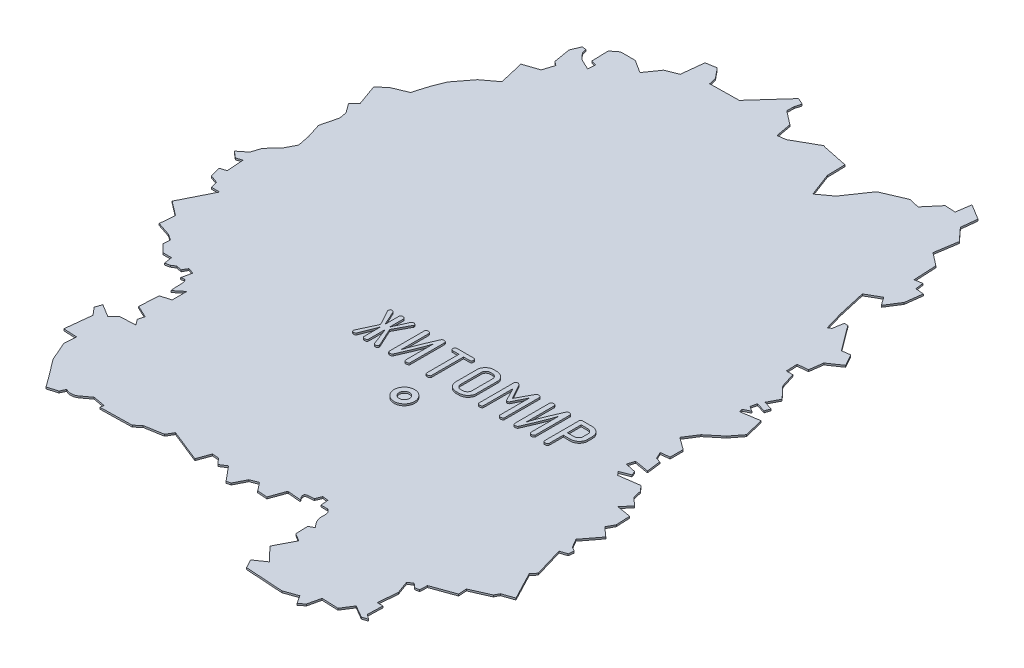
from build123d import *

# Parameters (mm, degrees)
EXTRUDE_1_DEPTH = 5
SKETCH_2_R      = 30
SKETCH_2_R_2    = 15
EXTRUDE_2_DEPTH = 10
SCALE_1_SCALE   = 0.05


with BuildPart() as part:
    # Эскиз1 → Бобышка-Вытянуть1 (new body)
    with BuildSketch(Plane(origin=(0, 0, 0), x_dir=(1, 0, 0), z_dir=(0, 1, 0))):
        with BuildLine():
            Line((-4534.03208, 8094.20784), (-4547.64648, 8104.5812))
            Line((-4547.64648, 8104.5812), (-4546.35616, 8148.71624))
            Line((-4546.35616, 8148.71624), (-4563.2116, 8148.71624))
            Line((-4563.2116, 8148.71624), (-4558.03508, 8205.16774))
            Line((-4558.03508, 8205.16774), (-4571.66218, 8242.80546))
            Line((-4571.66218, 8242.80546), (-4558.03508, 8251.24842))
            Line((-4558.03508, 8251.24842), (-4546.35616, 8240.86744))
            Line((-4546.35616, 8240.86744), (-4534.03208, 8242.80546))
            Line((-4534.03208, 8242.80546), (-4532.72652, 8264.86536))
            Line((-4532.72652, 8264.86536), (-4465.8915, 8288.88868))
            Line((-4465.8915, 8288.88868), (-4467.84222, 8312.90184))
            Line((-4467.84222, 8312.90184), (-4413.32112, 8336.90484))
            Line((-4413.32112, 8336.90484), (-4406.19134, 8350.5294))
            Line((-4406.19134, 8350.5294), (-4372.44744, 8362.21594))
            Line((-4372.44744, 8362.21594), (-4414.62668, 8442.68568))
            Line((-4414.62668, 8442.68568), (-4402.92744, 8457.60056))
            Line((-4402.92744, 8457.60056), (-4428.23854, 8543.27222))
            Line((-4428.23854, 8543.27222), (-4408.12936, 8549.76192))
            Line((-4408.12936, 8549.76192), (-4406.19134, 8565.3372))
            Line((-4406.19134, 8565.3372), (-4418.51542, 8572.46952))
            Line((-4418.51542, 8572.46952), (-4433.42268, 8597.77554))
            Line((-4433.42268, 8597.77554), (-4395.80782, 8647.10234))
            Line((-4395.80782, 8647.10234), (-4423.04424, 8671.11296))
            Line((-4423.04424, 8671.11296), (-4411.37802, 8693.17286))
            Line((-4411.37802, 8693.17286), (-4413.32112, 8734.06178))
            Line((-4413.32112, 8734.06178), (-4455.50798, 8741.20172))
            Line((-4455.50798, 8741.20172), (-4432.14506, 8766.50012))
            Line((-4432.14506, 8766.50012), (-4455.50798, 8789.21534))
            Line((-4455.50798, 8789.21534), (-4460.69212, 8812.58842))
            Line((-4460.69212, 8812.58842), (-4474.33192, 8828.15862))
            Line((-4474.33192, 8828.15862), (-4534.03208, 8819.72328))
            Line((-4534.03208, 8819.72328), (-4543.10496, 8830.11188))
            Line((-4543.10496, 8830.11188), (-4513.89496, 8841.77556))
            Line((-4513.89496, 8841.77556), (-4519.09942, 8854.11742))
            Line((-4519.09942, 8854.11742), (-4549.59466, 8860.58426))
            Line((-4549.59466, 8860.58426), (-4543.10496, 8881.34876))
            Line((-4543.10496, 8881.34876), (-4501.57596, 8874.2393))
            Line((-4501.57596, 8874.2393), (-4506.75756, 8915.10536))
            Line((-4506.75756, 8915.10536), (-4520.39736, 8919.0068))
            Line((-4520.39736, 8919.0068), (-4529.46262, 8939.12614))
            Line((-4529.46262, 8939.12614), (-4503.53176, 8942.38496))
            Line((-4503.53176, 8942.38496), (-4503.53176, 8979.99728))
            Line((-4503.53176, 8979.99728), (-4539.20606, 9005.96624))
            Line((-4539.20606, 9005.96624), (-4515.20814, 9043.59888))
            Line((-4515.20814, 9043.59888), (-4474.33192, 9077.34786))
            Line((-4474.33192, 9077.34786), (-4449.02082, 9109.79128))
            Line((-4449.02082, 9109.79128), (-4462.6403, 9166.2504))
            Line((-4462.6403, 9166.2504), (-4517.14616, 9157.8049))
            Line((-4517.14616, 9157.8049), (-4519.09942, 9167.55342))
            Line((-4519.09942, 9167.55342), (-4500.27548, 9176.63138))
            Line((-4500.27548, 9176.63138), (-4515.20814, 9186.36212))
            Line((-4515.20814, 9186.36212), (-4510.659, 9203.8805))
            Line((-4510.659, 9203.8805), (-4483.39972, 9195.45024))
            Line((-4483.39972, 9195.45024), (-4478.20796, 9210.37782))
            Line((-4478.20796, 9210.37782), (-4503.53176, 9218.82332))
            Line((-4503.53176, 9218.82332), (-4486.656, 9251.23626))
            Line((-4486.656, 9251.23626), (-4519.09942, 9285.66088))
            Line((-4519.09942, 9285.66088), (-4532.72652, 9328.48528))
            Line((-4532.72652, 9328.48528), (-4551.5403, 9328.48528))
            Line((-4551.5403, 9328.48528), (-4552.84586, 9360.91854))
            Line((-4552.84586, 9360.91854), (-4522.33538, 9364.17736))
            Line((-4522.33538, 9364.17736), (-4517.14616, 9403.14096))
            Line((-4517.14616, 9403.14096), (-4479.50336, 9429.05912))
            Line((-4479.50336, 9429.05912), (-4498.33238, 9462.83096))
            Line((-4498.33238, 9462.83096), (-4522.33538, 9459.57976))
            Line((-4522.33538, 9459.57976), (-4576.84632, 9532.89686))
            Line((-4576.84632, 9532.89686), (-4587.24, 9532.89686))
            Line((-4587.24, 9532.89686), (-4592.41906, 9502.40162))
            Line((-4592.41906, 9502.40162), (-4600.85948, 9497.21748))
            Line((-4600.85948, 9497.21748), (-4616.43476, 9550.41016))
            Line((-4616.43476, 9550.41016), (-4635.25362, 9633.48086))
            Line((-4635.25362, 9633.48086), (-4595.67534, 9656.20116))
            Line((-4595.67534, 9656.20116), (-4578.79958, 9632.19308))
            Line((-4578.79958, 9632.19308), (-4552.84586, 9673.05406))
            Line((-4552.84586, 9673.05406), (-4546.35616, 9722.38086))
            Line((-4546.35616, 9722.38086), (-4570.35916, 9724.34682))
            Line((-4570.35916, 9724.34682), (-4573.61544, 9748.34982))
            Line((-4573.61544, 9748.34982), (-4595.67534, 9744.44076))
            Line((-4595.67534, 9744.44076), (-4598.92908, 9811.30626))
            Line((-4598.92908, 9811.30626), (-4636.53632, 9840.47816))
            Line((-4636.53632, 9840.47816), (-4626.17058, 9906.68072))
            Line((-4626.17058, 9906.68072), (-4660.55456, 9944.33114))
            Line((-4660.55456, 9944.33114), (-4655.37042, 9990.40674))
            Line((-4655.37042, 9990.40674), (-4700.1557, 10017.65586))
            Line((-4700.1557, 10017.65586), (-4706.63524, 9974.83146))
            Line((-4706.63524, 9974.83146), (-4737.14572, 9976.77456))
            Line((-4737.14572, 9976.77456), (-4773.4855, 9933.94762))
            Line((-4773.4855, 9933.94762), (-4803.96296, 9941.07994))
            Line((-4803.96296, 9941.07994), (-4872.1137, 9911.86486))
            Line((-4872.1137, 9911.86486), (-4920.14002, 9841.79642))
            Line((-4920.14002, 9841.79642), (-4959.08076, 9813.24428))
            Line((-4959.08076, 9813.24428), (-4985.03956, 9881.3747))
            Line((-4985.03956, 9881.3747), (-4986.34258, 9933.94762))
            Line((-4986.34258, 9933.94762), (-5061.60278, 9949.53306))
            Line((-5061.60278, 9949.53306), (-5064.8489, 9951.4533))
            Line((-5064.8489, 9951.4533), (-5134.94528, 9911.86486))
            Line((-5134.94528, 9911.86486), (-5158.95082, 9908.62382))
            Line((-5158.95082, 9908.62382), (-5167.38108, 9954.69942))
            Line((-5167.38108, 9954.69942), (-5206.9619, 9985.21244))
            Line((-5206.9619, 9985.21244), (-5206.9619, 10005.96424))
            Line((-5206.9619, 10005.96424), (-5201.76506, 10024.7704))
            Line((-5201.76506, 10024.7704), (-5220.60424, 10033.23622))
            Line((-5220.60424, 10033.23622), (-5302.34144, 9942.37788))
            Line((-5302.34144, 9942.37788), (-5387.35778, 9941.07994))
            Line((-5387.35778, 9941.07994), (-5392.5724, 9963.14492))
            Line((-5392.5724, 9963.14492), (-5416.58556, 9992.34984))
            Line((-5416.58556, 9992.34984), (-5447.05794, 9987.14284))
            Line((-5447.05794, 9987.14284), (-5454.20296, 9922.26616))
            Line((-5454.20296, 9922.26616), (-5488.6098, 9908.62382))
            Line((-5488.6098, 9908.62382), (-5517.14924, 9867.74252))
            Line((-5517.14924, 9867.74252), (-5554.80474, 9891.77092))
            Line((-5554.80474, 9891.77092), (-5597.62914, 9891.77092))
            Line((-5597.62914, 9891.77092), (-5617.74594, 9876.17278))
            Line((-5617.74594, 9876.17278), (-5616.448, 9826.87138))
            Line((-5616.448, 9826.87138), (-5600.87526, 9822.96994))
            Line((-5600.87526, 9822.96994), (-5602.80566, 9800.90496))
            Line((-5602.80566, 9800.90496), (-5635.26178, 9816.46246))
            Line((-5635.26178, 9816.46246), (-5650.19444, 9833.36108))
            Line((-5650.19444, 9833.36108), (-5654.08318, 9846.9704))
            Line((-5654.08318, 9846.9704), (-5665.77734, 9848.93636))
            Line((-5665.77734, 9848.93636), (-5677.44356, 9821.67454))
            Line((-5677.44356, 9821.67454), (-5669.01584, 9771.70004))
            Line((-5669.01584, 9771.70004), (-5657.33438, 9763.2774))
            Line((-5657.33438, 9763.2774), (-5667.70774, 9730.82636))
            Line((-5667.70774, 9730.82636), (-5711.8377, 9715.89878))
            Line((-5711.8377, 9715.89878), (-5694.96194, 9643.86692))
            Line((-5694.96194, 9643.86692), (-5735.8661, 9613.3539))
            Line((-5735.8661, 9613.3539), (-5773.49874, 9564.04488))
            add(Edge.make_bspline(
                [(-5773.49874, 9564.04488), (-5790.35926, 9523.15088), (-5793.59268, 9508.88624)],
                knots=[0.538135593, 0.538135593, 0.538135593, 0.542372881, 0.542372881, 0.542372881], degree=2))
            add(Edge.make_bspline(
                [(-5793.59268, 9508.88624), (-5797.4865, 9495.26168), (-5800.73008, 9483.58784)],
                knots=[0.542372881, 0.542372881, 0.542372881, 0.546610169, 0.546610169, 0.546610169], degree=2))
            Line((-5800.73008, 9483.58784), (-5841.62916, 9466.69176))
            Line((-5841.62916, 9466.69176), (-5868.88336, 9444.63186))
            Line((-5868.88336, 9444.63186), (-5846.8133, 9383.00384))
            Line((-5846.8133, 9383.00384), (-5863.69414, 9366.12046))
            Line((-5863.69414, 9366.12046), (-5843.56718, 9338.2211))
            Line((-5843.56718, 9338.2211), (-5839.67336, 9316.1612))
            Line((-5839.67336, 9316.1612), (-5852.00252, 9266.82424))
            Line((-5852.00252, 9266.82424), (-5838.37796, 9224.01254))
            Line((-5838.37796, 9224.01254), (-5831.2431, 9188.31538))
            Line((-5831.2431, 9188.31538), (-5848.11886, 9155.85926))
            Line((-5848.11886, 9155.85926), (-5855.25372, 9149.37464))
            Line((-5855.25372, 9149.37464), (-5876.01822, 9126.67466))
            Line((-5876.01822, 9126.67466), (-5884.45102, 9099.40522))
            Line((-5884.45102, 9099.40522), (-5909.75958, 9079.29604))
            Line((-5909.75958, 9079.29604), (-5890.94326, 9063.7106))
            Line((-5890.94326, 9063.7106), (-5874.07258, 9068.89474))
            Line((-5874.07258, 9068.89474), (-5870.83408, 9019.59842))
            Line((-5870.83408, 9019.59842), (-5889.00016, 9013.74372))
            Line((-5889.00016, 9013.74372), (-5880.5572, 8983.24848))
            Line((-5880.5572, 8983.24848), (-5857.2146, 8974.81314))
            Line((-5857.2146, 8974.81314), (-5852.00252, 8954.69634))
            Line((-5852.00252, 8954.69634), (-5827.99444, 8954.69634))
            Line((-5827.99444, 8954.69634), (-5874.07258, 8862.53244))
            Line((-5874.07258, 8862.53244), (-5833.19382, 8831.39712))
            Line((-5833.19382, 8831.39712), (-5836.43994, 8787.26716))
            Line((-5836.43994, 8787.26716), (-5795.54086, 8773.64006))
            Line((-5795.54086, 8773.64006), (-5778.6778, 8761.95352))
            Line((-5778.6778, 8761.95352), (-5779.97828, 8741.20172))
            Line((-5779.97828, 8741.20172), (-5757.90822, 8719.12912))
            Line((-5757.90822, 8719.12912), (-5732.60474, 8719.12912))
            Line((-5732.60474, 8719.12912), (-5728.72616, 8695.10834))
            Line((-5728.72616, 8695.10834), (-5715.1016, 8698.35446))
            Line((-5715.1016, 8698.35446), (-5703.38712, 8705.50202))
            Line((-5703.38712, 8705.50202), (-5687.82962, 8702.26098))
            Line((-5687.82962, 8702.26098), (-5679.38666, 8717.18602))
            Line((-5679.38666, 8717.18602), (-5662.51852, 8710.69124))
            Line((-5662.51852, 8710.69124), (-5669.01584, 8681.49648))
            add(Edge.make_bspline(
                [(-5669.01584, 8681.49648), (-5652.13754, 8689.9496), (-5652.13754, 8665.91612)],
                knots=[0.703389831, 0.703389831, 0.703389831, 0.707627119, 0.707627119, 0.707627119], degree=2))
            add(Edge.make_bspline(
                [(-5652.13754, 8665.91612), (-5652.13754, 8641.90804), (-5650.19444, 8635.42342)],
                knots=[0.707627119, 0.707627119, 0.707627119, 0.711864407, 0.711864407, 0.711864407], degree=2))
            Line((-5650.19444, 8635.42342), (-5624.89096, 8656.18792))
            Line((-5624.89096, 8656.18792), (-5624.89096, 8613.35844))
            Line((-5624.89096, 8613.35844), (-5654.08318, 8604.9231))
            Line((-5654.08318, 8604.9231), (-5657.33438, 8548.44874))
            Line((-5657.33438, 8548.44874), (-5621.65246, 8531.58568))
            Line((-5621.65246, 8531.58568), (-5626.84168, 8514.0673))
            Line((-5626.84168, 8514.0673), (-5614.5049, 8497.18646))
            Line((-5614.5049, 8497.18646), (-5659.27748, 8495.2459))
            Line((-5659.27748, 8495.2459), (-5677.44356, 8478.37014))
            Line((-5677.44356, 8478.37014), (-5713.7935, 8500.43512))
            Line((-5713.7935, 8500.43512), (-5720.27812, 8481.62388))
            Line((-5720.27812, 8481.62388), (-5701.45418, 8459.5462))
            Line((-5701.45418, 8459.5462), (-5709.88952, 8382.98044))
            Line((-5709.88952, 8382.98044), (-5670.94624, 8381.02464))
            Line((-5670.94624, 8381.02464), (-5672.90204, 8345.3351))
            Line((-5672.90204, 8345.3351), (-5648.88126, 8290.83686))
            Line((-5648.88126, 8290.83686), (-5604.12138, 8231.12654))
            Line((-5604.12138, 8231.12654), (-5589.19888, 8210.3722))
            Line((-5589.19888, 8210.3722), (-5559.98126, 8218.80754))
            Line((-5559.98126, 8218.80754), (-5552.85402, 8234.37774))
            add(Edge.make_bspline(
                [(-5552.85402, 8234.37774), (-5532.73976, 8223.9866), (-5515.88178, 8237.62386)],
                knots=[0.796610169, 0.796610169, 0.796610169, 0.800847458, 0.800847458, 0.800847458], degree=2))
            add(Edge.make_bspline(
                [(-5515.88178, 8237.62386), (-5498.34562, 8251.24842), (-5493.1564, 8254.492)],
                knots=[0.800847458, 0.800847458, 0.800847458, 0.805084746, 0.805084746, 0.805084746], degree=2))
            Line((-5493.1564, 8254.492), (-5457.45924, 8247.99722))
            Line((-5457.45924, 8247.99722), (-5459.39726, 8237.62386))
            Line((-5459.39726, 8237.62386), (-5367.2486, 8239.57204))
            Line((-5367.2486, 8239.57204), (-5350.37792, 8254.492))
            Line((-5350.37792, 8254.492), (-5297.17, 8263.58774))
            Line((-5297.17, 8263.58774), (-5285.47838, 8283.69184))
            Line((-5285.47838, 8283.69184), (-5191.39932, 8246.05666))
            Line((-5191.39932, 8246.05666), (-5177.75952, 8283.69184))
            Line((-5177.75952, 8283.69184), (-5158.95082, 8282.39644))
            Line((-5158.95082, 8282.39644), (-5143.38316, 8264.86536))
            Line((-5143.38316, 8264.86536), (-5124.55668, 8277.1996))
            Line((-5124.55668, 8277.1996), (-5088.8646, 8234.37774))
            Line((-5088.8646, 8234.37774), (-5077.19076, 8237.62386))
            Line((-5077.19076, 8237.62386), (-5059.6546, 8272.01038))
            Line((-5059.6546, 8272.01038), (-5037.57692, 8280.44064))
            Line((-5037.57692, 8280.44064), (-5018.78854, 8256.44272))
            Line((-5018.78854, 8256.44272), (-4990.2237, 8254.492))
            Line((-4990.2237, 8254.492), (-4974.63826, 8297.32402))
            Line((-4974.63826, 8297.32402), (-4971.4023, 8299.27728))
            Line((-4971.4023, 8299.27728), (-4933.75696, 8296.01338))
            add(Edge.make_bspline(
                [(-4933.75696, 8296.01338), (-4950.62764, 8316.15558), (-4933.75696, 8318.08598)],
                knots=[0.889830508, 0.889830508, 0.889830508, 0.894067797, 0.894067797, 0.894067797], degree=2))
            Line((-4933.75696, 8318.08598), (-4916.8939, 8319.39408))
            Line((-4916.8939, 8319.39408), (-4909.76666, 8336.90484))
            Line((-4909.76666, 8336.90484), (-4892.88836, 8334.96682))
            Line((-4892.88836, 8334.96682), (-4890.94018, 8312.90184))
            Line((-4890.94018, 8312.90184), (-4872.1137, 8312.90184))
            add(Edge.make_bspline(
                [(-4872.1137, 8312.90184), (-4858.48406, 8307.69484), (-4860.43224, 8286.93288)],
                knots=[0.915254237, 0.915254237, 0.915254237, 0.919491525, 0.919491525, 0.919491525], degree=2))
            add(Edge.make_bspline(
                [(-4860.43224, 8286.93288), (-4861.74034, 8266.81608), (-4841.61846, 8247.99722)],
                knots=[0.919491525, 0.919491525, 0.919491525, 0.923728814, 0.923728814, 0.923728814], degree=2))
            Line((-4841.61846, 8247.99722), (-4856.53588, 8239.57204))
            Line((-4856.53588, 8239.57204), (-4855.23286, 8203.87488))
            Line((-4855.23286, 8203.87488), (-4833.19074, 8190.25286))
            Line((-4833.19074, 8190.25286), (-4861.74034, 8135.0993))
            Line((-4861.74034, 8135.0993), (-4822.78944, 8094.20784))
            Line((-4822.78944, 8094.20784), (-4855.23286, 8072.14032))
            Line((-4855.23286, 8072.14032), (-4841.61846, 8046.83684))
            Line((-4841.61846, 8046.83684), (-4731.9565, 8039.6842))
            Line((-4731.9565, 8039.6842), (-4693.01068, 8053.32146))
            Line((-4693.01068, 8053.32146), (-4677.43032, 8029.31338))
            Line((-4677.43032, 8029.31338), (-4662.51036, 8042.93794))
            Line((-4662.51036, 8042.93794), (-4654.06232, 8079.2828))
            Line((-4654.06232, 8079.2828), (-4606.03854, 8077.33208))
            Line((-4606.03854, 8077.33208), (-4585.2842, 8109.77042))
            Line((-4585.2842, 8109.77042), (-4549.59466, 8089.00592))
            Line((-4549.59466, 8089.00592), (-4534.03208, 8094.20784))
        make_face()
    extrude(amount=EXTRUDE_1_DEPTH)

    # Эскиз2 → Бобышка-Вытянуть2 (add)
    # profile 1 of 8: a face of its own
    with BuildSketch(Plane(origin=(0, 0, 0), x_dir=(1, 0, 0), z_dir=(0, 1, 0))):
        with Locations((-5040.921357821, 8705.513522828)):
            Circle(SKETCH_2_R)
        with Locations((-5040.921357821, 8705.513522828)):
            Circle(SKETCH_2_R_2, mode=Mode.SUBTRACT)
    # profile 2 of 8: a face of its own
    with BuildSketch(Plane(origin=(0, 0, 0), x_dir=(1, 0, 0), z_dir=(0, 1, 0))):
        with BuildLine():
            Line((-5235.044519459, 8856.345763436), (-5215.720195135, 8899.477097895))
            add(Edge.make_bspline(
                [(-5215.720195135, 8899.477097895), (-5215.447552976, 8899.912742392), (-5214.925898163, 8900.746274704), (-5213.826145908, 8901.675135607), (-5212.551803219, 8902.258572021), (-5211.63867427, 8902.323622805), (-5211.16783027, 8902.357165463)],
                knots=[0, 0, 0, 0, 1.08367056, 2.073420948, 3.006582599, 4, 4, 4, 4], degree=3))
            add(Edge.make_bspline(
                [(-5211.16783027, 8902.357165463), (-5210.61749674, 8902.336715346), (-5209.581150137, 8902.298205227), (-5208.128607422, 8902.085990385), (-5206.886084355, 8901.669929196), (-5205.874182527, 8901.063223473), (-5205.063635257, 8900.294099051), (-5204.497485605, 8899.339207453), (-5204.170385376, 8898.212581613), (-5204.128837464, 8897.412188015), (-5204.107019459, 8896.991878301)],
                knots=[0, 0, 0, 0, 1.307585369, 2.462346159, 3.474162086, 4.39812442, 5.243351347, 6.101086129, 7.002825675, 8, 8, 8, 8], degree=3))
            add(Edge.make_bspline(
                [(-5204.107019459, 8896.991878301), (-5204.122749829, 8896.685974431), (-5204.152090821, 8896.115388813), (-5204.502093551, 8895.666956641), (-5204.664451892, 8895.458939111)],
                knots=[0, 0, 0, 0, 1.072245288, 2, 2, 2, 2], degree=3))
            Line((-5204.664451892, 8895.458939111), (-5228.726951892, 8850.260459382))
            Line((-5228.726951892, 8850.260459382), (-5204.850262703, 8798.605053976))
            add(Edge.make_bspline(
                [(-5204.850262703, 8798.605053976), (-5204.635496002, 8798.133024247), (-5204.266716958, 8797.322495092), (-5204.154065732, 8796.441365713), (-5204.107019459, 8796.073381679)],
                knots=[0, 0, 0, 0, 1.164744604, 2, 2, 2, 2], degree=3))
            add(Edge.make_bspline(
                [(-5204.107019459, 8796.073381679), (-5204.132238547, 8795.669548426), (-5204.180534174, 8794.896190525), (-5204.464614269, 8793.799211728), (-5205.033605898, 8792.886650606), (-5205.787894231, 8792.110808305), (-5206.802476837, 8791.574592496), (-5207.984795839, 8791.135796558), (-5209.39612967, 8790.93113889), (-5210.401055248, 8790.891671403), (-5210.935566757, 8790.870678976)],
                knots=[0, 0, 0, 0, 0.9922728, 1.900244727, 2.743954077, 3.603549897, 4.5223843, 5.531780499, 6.687174694, 8, 8, 8, 8], degree=3))
            add(Edge.make_bspline(
                [(-5210.935566757, 8790.870678976), (-5211.476403395, 8790.907605193), (-5212.511259878, 8790.978261159), (-5213.938471072, 8791.616784104), (-5215.080331509, 8792.699436079), (-5215.575855192, 8793.632109167), (-5215.836326892, 8794.122368165)],
                knots=[0, 0, 0, 0, 1.035208426, 1.980805432, 2.938611697, 4, 4, 4, 4], degree=3))
            Line((-5215.836326892, 8794.122368165), (-5235.044519459, 8844.151928976))
            Line((-5235.044519459, 8844.151928976), (-5235.044519459, 8796.235966138))
            add(Edge.make_bspline(
                [(-5235.044519459, 8796.235966138), (-5235.064041211, 8795.815002994), (-5235.101322495, 8795.011076821), (-5235.461155188, 8793.887001358), (-5236.0485334, 8792.923561205), (-5236.909662856, 8792.165494543), (-5237.970469254, 8791.55219605), (-5239.277378259, 8791.143885328), (-5240.805148469, 8790.928357889), (-5241.895580151, 8790.890736891), (-5242.476951892, 8790.870678976)],
                knots=[0, 0, 0, 0, 0.966526808, 1.845805764, 2.686487088, 3.531690263, 4.457941251, 5.489333743, 6.661419661, 8, 8, 8, 8], degree=3))
            add(Edge.make_bspline(
                [(-5242.476951892, 8790.870678976), (-5242.94234459, 8790.890767268), (-5243.81755843, 8790.928545152), (-5245.047651756, 8791.146169527), (-5246.101203717, 8791.56238172), (-5246.949163942, 8792.181370745), (-5247.636304727, 8792.948438389), (-5248.095484682, 8793.906008513), (-5248.378273452, 8795.019826641), (-5248.407487997, 8795.816004825), (-5248.422897838, 8796.235966138)],
                knots=[0, 0, 0, 0, 1.21810231, 2.290753602, 3.253748033, 4.153293275, 5.014621679, 5.920530636, 6.903139142, 8, 8, 8, 8], degree=3))
            Line((-5248.422897838, 8796.235966138), (-5248.422897838, 8843.849986409))
            Line((-5248.422897838, 8843.849986409), (-5267.654316757, 8793.959783706))
            add(Edge.make_bspline(
                [(-5267.654316757, 8793.959783706), (-5267.94309168, 8793.48594188), (-5268.519724231, 8792.539763387), (-5269.939262556, 8791.536853233), (-5271.712415273, 8790.946067422), (-5273.014226966, 8790.897094079), (-5273.716394459, 8790.870678976)],
                knots=[0, 0, 0, 0, 0.91842489, 1.833932402, 2.831672611, 4, 4, 4, 4], degree=3))
            add(Edge.make_bspline(
                [(-5273.716394459, 8790.870678976), (-5274.142960596, 8790.891095102), (-5274.94879403, 8790.929663557), (-5276.089517131, 8791.14634602), (-5277.050121468, 8791.569688206), (-5277.860435397, 8792.140306094), (-5278.468366361, 8792.900197981), (-5278.896879056, 8793.82394652), (-5279.145047839, 8794.899251576), (-5279.179661412, 8795.669467109), (-5279.197813378, 8796.073381679)],
                knots=[0, 0, 0, 0, 1.184370061, 2.237413877, 3.199106753, 4.075474386, 4.961005186, 5.864072952, 6.879882294, 8, 8, 8, 8], degree=3))
            add(Edge.make_bspline(
                [(-5279.197813378, 8796.073381679), (-5279.174654937, 8796.481567403), (-5279.127418154, 8797.314152816), (-5278.789436427, 8798.076896898), (-5278.617154595, 8798.465695868)],
                knots=[0, 0, 0, 0, 0.980525764, 2, 2, 2, 2], degree=3))
            Line((-5278.617154595, 8798.465695868), (-5254.577880946, 8850.144327625))
            Line((-5254.577880946, 8850.144327625), (-5278.501022838, 8894.320847895))
            add(Edge.make_bspline(
                [(-5278.501022838, 8894.320847895), (-5278.698424858, 8894.747361508), (-5279.091173285, 8895.595947305), (-5279.16239093, 8896.528194404), (-5279.197813378, 8896.991878301)],
                knots=[0, 0, 0, 0, 1.005233919, 2, 2, 2, 2], degree=3))
            add(Edge.make_bspline(
                [(-5279.197813378, 8896.991878301), (-5279.179993594, 8897.411309853), (-5279.1462884, 8898.204642792), (-5278.895871091, 8899.320129436), (-5278.456807076, 8900.269880213), (-5277.823217858, 8901.037545569), (-5277.043840079, 8901.665208284), (-5276.056890755, 8902.082125901), (-5274.902629225, 8902.298214013), (-5274.081172474, 8902.336772444), (-5273.646715405, 8902.357165463)],
                knots=[0, 0, 0, 0, 1.137340688, 2.151220681, 3.081358687, 3.94738892, 4.829820309, 5.770335428, 6.82076137, 8, 8, 8, 8], degree=3))
            add(Edge.make_bspline(
                [(-5273.646715405, 8902.357165463), (-5272.9917798, 8902.325288781), (-5271.764946263, 8902.265576984), (-5270.077730903, 8901.727027515), (-5268.693296585, 8900.806132831), (-5268.108400953, 8899.919151046), (-5267.816901216, 8899.477097895)],
                knots=[0, 0, 0, 0, 1.147617683, 2.149731744, 3.077865041, 4, 4, 4, 4], degree=3))
            Line((-5267.816901216, 8899.477097895), (-5248.422897838, 8856.647706003))
            Line((-5248.422897838, 8856.647706003), (-5248.422897838, 8896.922199246))
            add(Edge.make_bspline(
                [(-5248.422897838, 8896.922199246), (-5248.407564754, 8897.349609443), (-5248.378744146, 8898.152984825), (-5248.097745142, 8899.288994431), (-5247.606954109, 8900.244978102), (-5246.940834966, 8901.057238432), (-5246.048025669, 8901.631283985), (-5244.994194272, 8902.059430234), (-5243.749882082, 8902.305987251), (-5242.857396454, 8902.339428918), (-5242.384046486, 8902.357165463)],
                knots=[0, 0, 0, 0, 1.101664502, 2.070727719, 2.99099469, 3.855584345, 4.74766418, 5.697383702, 6.778755293, 8, 8, 8, 8], degree=3))
            add(Edge.make_bspline(
                [(-5242.384046486, 8902.357165463), (-5241.809899204, 8902.34039693), (-5240.732645513, 8902.308934684), (-5239.225449291, 8902.051994722), (-5237.935799615, 8901.653999795), (-5236.870666151, 8901.05813166), (-5236.021183022, 8900.284313715), (-5235.471106131, 8899.292084193), (-5235.09630235, 8898.164258078), (-5235.062416812, 8897.351483221), (-5235.044519459, 8896.922199246)],
                knots=[0, 0, 0, 0, 1.324251331, 2.484649284, 3.518749735, 4.423044346, 5.282625393, 6.13155354, 7.013141075, 8, 8, 8, 8], degree=3))
            Line((-5235.044519459, 8896.922199246), (-5235.044519459, 8856.345763436))
        make_face()
    # profile 3 of 8: a face of its own
    with BuildSketch(Plane(origin=(0, 0, 0), x_dir=(1, 0, 0), z_dir=(0, 1, 0))):
        with BuildLine():
            add(Edge.make_bspline(
                [(-5115.233708649, 8797.652773571), (-5115.254387782, 8797.239956294), (-5115.294231203, 8796.444562572), (-5115.643583111, 8795.330114687), (-5116.246912519, 8794.386018159), (-5117.091569407, 8793.624731223), (-5118.167658908, 8793.044785275), (-5119.465176532, 8792.628044015), (-5120.994764632, 8792.415558948), (-5122.084917821, 8792.377471871), (-5122.666141081, 8792.357165463)],
                knots=[0, 0, 0, 0, 0.953740082, 1.837614163, 2.667550865, 3.517171085, 4.439430397, 5.476212962, 6.654424219, 8, 8, 8, 8], degree=3))
            add(Edge.make_bspline(
                [(-5122.666141081, 8792.357165463), (-5123.131392255, 8792.377446572), (-5124.006339946, 8792.415587067), (-5125.23818802, 8792.630820711), (-5126.281840695, 8793.05313412), (-5127.146020506, 8793.642048073), (-5127.817337806, 8794.409286616), (-5128.286211663, 8795.343783561), (-5128.567173527, 8796.43668562), (-5128.596569794, 8797.217423673), (-5128.612087027, 8797.629547219)],
                knots=[0, 0, 0, 0, 1.228791976, 2.310856505, 3.282301858, 4.177930221, 5.04681736, 5.942445723, 6.913891076, 8, 8, 8, 8], degree=3))
            Line((-5128.612087027, 8797.629547219), (-5128.612087027, 8877.597874922))
            add(Edge.make_bspline(
                [(-5128.612087027, 8877.597874922), (-5128.877125109, 8876.636098765), (-5129.439495126, 8874.595357789), (-5130.452919551, 8871.414055512), (-5131.585219902, 8867.907271391), (-5132.922418084, 8864.104853079), (-5134.397182157, 8859.981601085), (-5136.060255154, 8855.558020815), (-5137.866126019, 8850.825250328), (-5139.843911844, 8845.786338442), (-5141.981169542, 8840.433418579), (-5144.305944287, 8834.777800429), (-5146.789877784, 8828.808007928), (-5149.444641934, 8822.532023695), (-5152.249133234, 8815.940914992), (-5155.225581145, 8809.044132617), (-5158.355237611, 8801.837889514), (-5160.529203976, 8796.946643828), (-5161.639958649, 8794.447537084)],
                knots=[0, 0, 0, 0, 0.534819233, 1.134804096, 1.789814632, 2.510503038, 3.295666462, 4.137599038, 5.044164315, 6.011541378, 7.039786653, 8.134359685, 9.289900099, 10.506440011, 11.787824629, 13.130253246, 14.53374704, 16, 16, 16, 16], degree=3))
            add(Edge.make_bspline(
                [(-5161.639958649, 8794.447537084), (-5162.003157391, 8793.899628355), (-5162.725381519, 8792.810106672), (-5164.418025745, 8791.663918415), (-5166.482299602, 8790.983983693), (-5167.990283047, 8790.910061626), (-5168.793674865, 8790.870678976)],
                knots=[0, 0, 0, 0, 0.931236219, 1.851772014, 2.855512113, 4, 4, 4, 4], degree=3))
            add(Edge.make_bspline(
                [(-5168.793674865, 8790.870678976), (-5169.259955238, 8790.885256344), (-5170.132495644, 8790.912534658), (-5171.353479634, 8791.197677701), (-5172.38707281, 8791.653611048), (-5173.247755504, 8792.308346736), (-5173.898831269, 8793.162146393), (-5174.376032861, 8794.198952026), (-5174.645662394, 8795.417274306), (-5174.676800644, 8796.288825147), (-5174.693168108, 8796.746945868)],
                knots=[0, 0, 0, 0, 1.171630376, 2.192446653, 3.134147218, 3.995415972, 4.884019595, 5.808017826, 6.847809664, 8, 8, 8, 8], degree=3))
            Line((-5174.693168108, 8796.746945868), (-5174.693168108, 8897.015104652))
            add(Edge.make_bspline(
                [(-5174.693168108, 8897.015104652), (-5174.677150791, 8897.434682694), (-5174.646784568, 8898.230134258), (-5174.373411067, 8899.342070157), (-5173.890773891, 8900.283059401), (-5173.236020548, 8901.072311158), (-5172.361738457, 8901.660209848), (-5171.319635569, 8902.08381587), (-5170.08731012, 8902.298651356), (-5169.212434835, 8902.336852241), (-5168.747222162, 8902.357165463)],
                knots=[0, 0, 0, 0, 1.098843442, 2.08322802, 2.972669788, 3.850929026, 4.740370794, 5.705105844, 6.779695961, 8, 8, 8, 8], degree=3))
            add(Edge.make_bspline(
                [(-5168.747222162, 8902.357165463), (-5168.16604524, 8902.336809729), (-5167.075978962, 8902.298630135), (-5165.54582354, 8902.086748976), (-5164.250091742, 8901.668106726), (-5163.163652941, 8901.091688683), (-5162.33522022, 8900.304922851), (-5161.723446919, 8899.362300405), (-5161.373299823, 8898.238696217), (-5161.334898153, 8897.435621792), (-5161.31478973, 8897.015104652)],
                knots=[0, 0, 0, 0, 1.340544031, 2.514349394, 3.547254935, 4.466065479, 5.324653274, 6.151486447, 7.032055301, 8, 8, 8, 8], degree=3))
            Line((-5161.31478973, 8897.015104652), (-5161.31478973, 8815.629969517))
            add(Edge.make_bspline(
                [(-5161.31478973, 8815.629969517), (-5161.057988937, 8816.591841678), (-5160.51499458, 8818.625679469), (-5159.518303581, 8821.807827381), (-5158.386676603, 8825.309600412), (-5157.081708805, 8829.117790759), (-5155.616245103, 8833.228336274), (-5153.988660341, 8837.651652963), (-5152.176486172, 8842.379268788), (-5150.193529201, 8847.412960982), (-5148.093424108, 8852.777638535), (-5145.752146107, 8858.420268329), (-5143.307651633, 8864.403158891), (-5140.642952752, 8870.660803094), (-5137.862664776, 8877.251098186), (-5134.892305936, 8884.142940855), (-5131.72514564, 8891.332714112), (-5129.57173083, 8896.232985824), (-5128.472728919, 8898.733854652)],
                knots=[0, 0, 0, 0, 0.534342487, 1.129844471, 1.789587048, 2.509780447, 3.29056652, 4.132056478, 5.039701852, 6.008231463, 7.036165613, 8.132042737, 9.287368917, 10.505358234, 11.78281919, 13.126847198, 14.533677579, 16, 16, 16, 16], degree=3))
            add(Edge.make_bspline(
                [(-5128.472728919, 8898.733854652), (-5128.128097131, 8899.28205994), (-5127.469088138, 8900.330344596), (-5126.070407111, 8901.516255071), (-5124.416247767, 8902.232720142), (-5123.230748384, 8902.314838135), (-5122.619688378, 8902.357165463)],
                knots=[0, 0, 0, 0, 1.068047448, 2.042333001, 2.990929877, 4, 4, 4, 4], degree=3))
            add(Edge.make_bspline(
                [(-5122.619688378, 8902.357165463), (-5122.037331315, 8902.343426024), (-5120.950087208, 8902.317774881), (-5119.436785883, 8902.026556635), (-5118.129339593, 8901.609626463), (-5117.06332999, 8900.952265075), (-5116.236358165, 8900.10401293), (-5115.643208046, 8899.077122224), (-5115.290169668, 8897.858156973), (-5115.25319274, 8896.986598014), (-5115.233708649, 8896.527351274)],
                knots=[0, 0, 0, 0, 1.29965344, 2.426416082, 3.433331493, 4.350449838, 5.194812866, 6.055508021, 6.975397369, 8, 8, 8, 8], degree=3))
            Line((-5115.233708649, 8896.527351274), (-5115.233708649, 8797.652773571))
        make_face()
    # profile 4 of 8: a face of its own
    with BuildSketch(Plane(origin=(0, 0, 0), x_dir=(1, 0, 0), z_dir=(0, 1, 0))):
        with BuildLine():
            Line((-5065.287762703, 8888.978787084), (-5083.032695135, 8888.978787084))
            add(Edge.make_bspline(
                [(-5083.032695135, 8888.978787084), (-5083.452441482, 8888.99462861), (-5084.248212123, 8889.024661559), (-5085.358013758, 8889.300264277), (-5086.30085772, 8889.772777549), (-5087.06443443, 8890.451761969), (-5087.682944671, 8891.300703691), (-5088.099298831, 8892.353964623), (-5088.316879651, 8893.584147236), (-5088.354664141, 8894.459347533), (-5088.374755946, 8894.92473303)],
                knots=[0, 0, 0, 0, 1.099344271, 2.084177511, 2.974024668, 3.837303213, 4.738885125, 5.70405988, 6.779139773, 8, 8, 8, 8], degree=3))
            add(Edge.make_bspline(
                [(-5088.374755946, 8894.92473303), (-5088.354664141, 8895.390118527), (-5088.316879651, 8896.265318825), (-5088.099298831, 8897.495501438), (-5087.682944671, 8898.548762369), (-5087.06443443, 8899.397704091), (-5086.30085772, 8900.076688511), (-5085.358013758, 8900.549201783), (-5084.248212123, 8900.824804501), (-5083.452441482, 8900.854837451), (-5083.032695135, 8900.870678976)],
                knots=[0, 0, 0, 0, 1.220860227, 2.29594012, 3.261114875, 4.162696787, 5.025975332, 5.915822489, 6.900655729, 8, 8, 8, 8], degree=3))
            Line((-5083.032695135, 8900.870678976), (-5035.558032973, 8900.870678976))
            add(Edge.make_bspline(
                [(-5035.558032973, 8900.870678976), (-5035.022244402, 8900.856128941), (-5034.019721411, 8900.828904126), (-5032.616193121, 8900.544652117), (-5031.414532918, 8900.09609377), (-5030.425258193, 8899.427689516), (-5029.659948374, 8898.565235244), (-5029.112575215, 8897.514573032), (-5028.822413292, 8896.271435668), (-5028.776827994, 8895.390679192), (-5028.752712027, 8894.92473303)],
                knots=[0, 0, 0, 0, 1.241478992, 2.322952188, 3.306951403, 4.198757046, 5.063935603, 5.955741246, 6.918526805, 8, 8, 8, 8], degree=3))
            add(Edge.make_bspline(
                [(-5028.752712027, 8894.92473303), (-5028.776827994, 8894.458786868), (-5028.822413292, 8893.578030392), (-5029.112575215, 8892.334893029), (-5029.659948374, 8891.284230817), (-5030.425258193, 8890.421776545), (-5031.414532918, 8889.753372291), (-5032.616193121, 8889.304813943), (-5034.019721411, 8889.020561935), (-5035.022244402, 8888.99333712), (-5035.558032973, 8888.978787084)],
                knots=[0, 0, 0, 0, 1.081473195, 2.044258754, 2.936064397, 3.801242954, 4.693048597, 5.677047812, 6.758521008, 8, 8, 8, 8], degree=3))
            Line((-5035.558032973, 8888.978787084), (-5051.909384324, 8888.978787084))
            Line((-5051.909384324, 8888.978787084), (-5051.909384324, 8796.119834382))
            add(Edge.make_bspline(
                [(-5051.909384324, 8796.119834382), (-5051.928866779, 8795.70656065), (-5051.966056211, 8794.917675673), (-5052.326206624, 8793.815976433), (-5052.914915407, 8792.875749063), (-5053.776348772, 8792.140628797), (-5054.841909007, 8791.556763692), (-5056.141309988, 8791.142050477), (-5057.670299782, 8790.92892114), (-5058.760544629, 8790.890932762), (-5059.341816757, 8790.870678976)],
                knots=[0, 0, 0, 0, 0.957214147, 1.827195396, 2.6601552, 3.500842069, 4.426460774, 5.467019893, 6.649522866, 8, 8, 8, 8], degree=3))
            add(Edge.make_bspline(
                [(-5059.341816757, 8790.870678976), (-5059.807106976, 8790.890925809), (-5060.682128094, 8790.929001843), (-5061.913492052, 8791.144660483), (-5062.958716398, 8791.565594153), (-5063.81284525, 8792.155809399), (-5064.500372387, 8792.900630324), (-5064.960480048, 8793.835305378), (-5065.243263171, 8794.926609597), (-5065.272388493, 8795.707585358), (-5065.287762703, 8796.119834382)],
                knots=[0, 0, 0, 0, 1.231142298, 2.315276502, 3.288579949, 4.185921389, 5.041168779, 5.938510218, 6.911813665, 8, 8, 8, 8], degree=3))
            Line((-5065.287762703, 8796.119834382), (-5065.287762703, 8888.978787084))
        make_face()
    # profile 5 of 8: a face of its own
    with BuildSketch(Plane(origin=(0, 0, 0), x_dir=(1, 0, 0), z_dir=(0, 1, 0))):
        with BuildLine():
            add(Edge.make_bspline(
                [(-4941.017492432, 8815.281574246), (-4941.040060961, 8814.483033407), (-4941.084759753, 8812.901458851), (-4941.433692046, 8810.569004006), (-4942.05409566, 8808.316755992), (-4942.883273368, 8806.132915368), (-4943.966096062, 8804.027481651), (-4945.275603244, 8801.999632067), (-4946.8177978, 8800.035217942), (-4948.589896933, 8798.185198919), (-4950.522695256, 8796.458353594), (-4952.627643167, 8794.986745521), (-4954.813261613, 8793.674898983), (-4957.158950826, 8792.67204906), (-4959.598528813, 8791.836625891), (-4962.174253726, 8791.300999354), (-4964.852528021, 8790.931929711), (-4966.681288296, 8790.891332625), (-4967.61166473, 8790.870678976)],
                knots=[0, 0, 0, 0, 0.955175484, 1.891802106, 2.813050817, 3.745408234, 4.681622557, 5.639981446, 6.629481268, 7.664661711, 8.701581189, 9.72450561, 10.733283354, 11.745245447, 12.770431959, 13.813291825, 14.887518622, 16, 16, 16, 16], degree=3))
            Line((-4967.61166473, 8790.870678976), (-4975.462171486, 8790.870678976))
            add(Edge.make_bspline(
                [(-4975.462171486, 8790.870678976), (-4976.307113969, 8790.894168813), (-4977.972332419, 8790.940462745), (-4980.430743918, 8791.273091416), (-4982.799744884, 8791.821074988), (-4985.065430813, 8792.625815292), (-4987.243382466, 8793.622102897), (-4989.311741809, 8794.866723765), (-4991.301510985, 8796.311547931), (-4993.161756964, 8797.974708951), (-4994.871014094, 8799.788704793), (-4996.361071027, 8801.732583769), (-4997.657989437, 8803.747280644), (-4998.671652765, 8805.886796515), (-4999.506863701, 8808.094031106), (-5000.045027771, 8810.415234424), (-5000.415056475, 8812.815451295), (-5000.456123681, 8814.451707821), (-5000.476951892, 8815.281574246)],
                knots=[0, 0, 0, 0, 1.043149238, 2.055845687, 3.05760797, 4.040256608, 5.019784463, 6.010076682, 7.015890737, 8.051962927, 9.086799385, 10.08878973, 11.072786086, 12.039115508, 13.007004251, 13.980870723, 14.97595055, 16, 16, 16, 16], degree=3))
            Line((-5000.476951892, 8815.281574246), (-5000.476951892, 8876.459783706))
            add(Edge.make_bspline(
                [(-5000.476951892, 8876.459783706), (-5000.455929365, 8877.289603009), (-5000.414479024, 8878.925766622), (-5000.048381437, 8881.31920957), (-4999.50253094, 8883.630754929), (-4998.672104174, 8885.831448907), (-4997.657844853, 8887.970790001), (-4996.361192777, 8889.985679398), (-4994.870664051, 8891.928947444), (-4993.163077227, 8893.745268827), (-4991.293216758, 8895.40282481), (-4989.316363271, 8896.885190507), (-4987.222897954, 8898.111114739), (-4985.043183148, 8899.117371113), (-4982.783018939, 8899.91576126), (-4980.423832539, 8900.471537834), (-4977.97218394, 8900.80030566), (-4976.307063989, 8900.846990692), (-4975.462171486, 8900.870678976)],
                knots=[0, 0, 0, 0, 1.024350526, 2.019722912, 2.984584598, 3.952757905, 4.919371433, 5.90365709, 6.905942025, 7.941082731, 8.977459532, 9.989234251, 10.988046002, 11.967861842, 12.950799385, 13.943549883, 14.95654407, 16, 16, 16, 16], degree=3))
            Line((-4975.462171486, 8900.870678976), (-4967.61166473, 8900.870678976))
            add(Edge.make_bspline(
                [(-4967.61166473, 8900.870678976), (-4966.681522893, 8900.849105068), (-4964.853223742, 8900.806699106), (-4962.169942483, 8900.450489621), (-4959.614319499, 8899.868748687), (-4957.163565584, 8899.080954349), (-4954.851246339, 8898.029551884), (-4952.63498589, 8896.764609379), (-4950.555200251, 8895.254162072), (-4948.610130364, 8893.536372521), (-4946.843617927, 8891.674442938), (-4945.273470595, 8889.726479885), (-4943.966488686, 8887.689934079), (-4942.889474268, 8885.590768741), (-4942.044396447, 8883.412262804), (-4941.440953879, 8881.162876906), (-4941.082250565, 8878.832690181), (-4941.039289239, 8877.258475424), (-4941.017492432, 8876.459783706)],
                knots=[0, 0, 0, 0, 1.113057418, 2.187840446, 3.233255027, 4.247266833, 5.263520674, 6.268172433, 7.297024944, 8.334481335, 9.370197792, 10.365962262, 11.324817386, 12.261516479, 13.185708152, 14.116382211, 15.044329928, 16, 16, 16, 16], degree=3))
            Line((-4941.017492432, 8876.459783706), (-4941.017492432, 8815.281574246))
        make_face()
        with BuildLine():
            Line((-4954.395870811, 8816.140949246), (-4954.395870811, 8875.600408706))
            add(Edge.make_bspline(
                [(-4954.395870811, 8875.600408706), (-4954.44377829, 8876.496359805), (-4954.537602714, 8878.251035655), (-4955.315388985, 8880.766915686), (-4956.575201448, 8883.076562379), (-4958.313468715, 8885.101430945), (-4960.355570573, 8886.827179619), (-4962.668015367, 8888.08425087), (-4965.189890276, 8888.828198207), (-4966.933201518, 8888.927986151), (-4967.820701892, 8888.978787084)],
                knots=[0, 0, 0, 0, 1.020875316, 1.999333742, 2.976114742, 4.00461091, 5.027434937, 6.011979822, 6.987921027, 8, 8, 8, 8], degree=3))
            Line((-4967.820701892, 8888.978787084), (-4975.229907973, 8888.978787084))
            add(Edge.make_bspline(
                [(-4975.229907973, 8888.978787084), (-4975.955227316, 8888.933373796), (-4977.416196771, 8888.841900395), (-4979.55370391, 8888.105547801), (-4981.564745851, 8886.881379978), (-4983.450863305, 8885.275392425), (-4985.085139331, 8883.300128352), (-4986.261312541, 8880.968520061), (-4986.977327067, 8878.367559952), (-4987.057320487, 8876.541907345), (-4987.098573514, 8875.600408706)],
                knots=[0, 0, 0, 0, 0.877717203, 1.767935789, 2.706167804, 3.717871189, 4.758407714, 5.790788373, 6.860697959, 8, 8, 8, 8], degree=3))
            Line((-4987.098573514, 8875.600408706), (-4987.098573514, 8816.140949246))
            add(Edge.make_bspline(
                [(-4987.098573514, 8816.140949246), (-4987.059227245, 8815.191201009), (-4986.983542052, 8813.364296382), (-4986.250484492, 8810.761936999), (-4985.093354199, 8808.421159345), (-4983.448714126, 8806.445370595), (-4981.572344052, 8804.831453629), (-4979.552223098, 8803.646156952), (-4977.426417776, 8802.892064652), (-4975.963656808, 8802.805828546), (-4975.229907973, 8802.762570868)],
                knots=[0, 0, 0, 0, 1.148029747, 2.20831245, 3.248494772, 4.28846567, 5.299619101, 6.232592159, 7.113434475, 8, 8, 8, 8], degree=3))
            Line((-4975.229907973, 8802.762570868), (-4967.820701892, 8802.762570868))
            add(Edge.make_bspline(
                [(-4967.820701892, 8802.762570868), (-4966.925506868, 8802.812871338), (-4965.174519078, 8802.911258288), (-4962.643333971, 8803.655591283), (-4960.342290971, 8804.917736255), (-4958.279669569, 8806.606854592), (-4956.577497922, 8808.661926924), (-4955.284749494, 8810.957371016), (-4954.545920555, 8813.495451775), (-4954.44663215, 8815.245986072), (-4954.395870811, 8816.140949246)],
                knots=[0, 0, 0, 0, 1.019985615, 1.995076279, 2.978763126, 3.995073656, 5.017006284, 6.004923721, 6.980014385, 8, 8, 8, 8], degree=3))
        make_face(mode=Mode.SUBTRACT)
    # profile 6 of 8: a face of its own
    with BuildSketch(Plane(origin=(0, 0, 0), x_dir=(1, 0, 0), z_dir=(0, 1, 0))):
        with BuildLine():
            add(Edge.make_bspline(
                [(-4839.044519459, 8796.212739787), (-4839.064483758, 8795.792052487), (-4839.10261019, 8794.988653102), (-4839.454641168, 8793.867273116), (-4840.056868848, 8792.921260601), (-4840.908656644, 8792.164876724), (-4841.970783235, 8791.552388836), (-4843.277277807, 8791.14382365), (-4844.805179305, 8790.928376823), (-4845.895590875, 8790.890743475), (-4846.476951892, 8790.870678976)],
                knots=[0, 0, 0, 0, 0.968349646, 1.849286893, 2.676465977, 3.523263178, 4.451261044, 5.484598709, 6.658895142, 8, 8, 8, 8], degree=3))
            add(Edge.make_bspline(
                [(-4846.476951892, 8790.870678976), (-4846.942337389, 8790.890770781), (-4847.817537686, 8790.928555271), (-4849.047720299, 8791.146136091), (-4850.100981231, 8791.562490251), (-4850.949922953, 8792.181000492), (-4851.628907373, 8792.944577202), (-4852.101420645, 8793.887421165), (-4852.377023363, 8794.997222799), (-4852.407056312, 8795.79299344), (-4852.422897838, 8796.212739787)],
                knots=[0, 0, 0, 0, 1.220860227, 2.29594012, 3.261114875, 4.162696787, 5.025975332, 5.915822489, 6.900655729, 8, 8, 8, 8], degree=3))
            Line((-4852.422897838, 8796.212739787), (-4852.422897838, 8881.17473303))
            Line((-4852.422897838, 8881.17473303), (-4871.259468784, 8843.664175598))
            add(Edge.make_bspline(
                [(-4871.259468784, 8843.664175598), (-4871.580690598, 8843.181925902), (-4872.202364518, 8842.248608037), (-4873.593298746, 8841.277548906), (-4875.198590803, 8840.625353651), (-4876.377537646, 8840.577148067), (-4876.996377568, 8840.551844517)],
                knots=[0, 0, 0, 0, 1.006547439, 1.948013064, 2.922893393, 4, 4, 4, 4], degree=3))
            add(Edge.make_bspline(
                [(-4876.996377568, 8840.551844517), (-4877.444608478, 8840.615812161), (-4878.399631012, 8840.752104728), (-4879.6579856, 8841.811567834), (-4880.750740954, 8843.394589395), (-4881.338849987, 8844.688731281), (-4881.664874189, 8845.406151949)],
                knots=[0, 0, 0, 0, 0.752435078, 1.603174698, 2.671295606, 4, 4, 4, 4], degree=3))
            Line((-4881.664874189, 8845.406151949), (-4899.990465405, 8881.17473303))
            Line((-4899.990465405, 8881.17473303), (-4899.990465405, 8796.212739787))
            add(Edge.make_bspline(
                [(-4899.990465405, 8796.212739787), (-4900.010429704, 8795.792052487), (-4900.048556136, 8794.988653102), (-4900.400587114, 8793.867273116), (-4901.002814794, 8792.921260601), (-4901.85460259, 8792.164876724), (-4902.916729181, 8791.552388836), (-4904.223223753, 8791.14382365), (-4905.751125251, 8790.928376823), (-4906.841536821, 8790.890743475), (-4907.422897838, 8790.870678976)],
                knots=[0, 0, 0, 0, 0.968349646, 1.849286893, 2.676465977, 3.523263178, 4.451261044, 5.484598709, 6.658895142, 8, 8, 8, 8], degree=3))
            add(Edge.make_bspline(
                [(-4907.422897838, 8790.870678976), (-4907.888283335, 8790.890770781), (-4908.763483632, 8790.928555271), (-4909.993666245, 8791.146136091), (-4911.046927177, 8791.562490251), (-4911.895868899, 8792.181000492), (-4912.574853319, 8792.944577202), (-4913.047366591, 8793.887421165), (-4913.322969309, 8794.997222799), (-4913.353002258, 8795.79299344), (-4913.368843784, 8796.212739787)],
                knots=[0, 0, 0, 0, 1.220860227, 2.29594012, 3.261114875, 4.162696787, 5.025975332, 5.915822489, 6.900655729, 8, 8, 8, 8], degree=3))
            Line((-4913.368843784, 8796.212739787), (-4913.368843784, 8896.387993165))
            add(Edge.make_bspline(
                [(-4913.368843784, 8896.387993165), (-4913.354636988, 8896.85465833), (-4913.327822026, 8897.735476831), (-4913.033225844, 8898.962685047), (-4912.617495355, 8900.040257113), (-4911.936546349, 8900.893757448), (-4911.099995959, 8901.571386931), (-4910.075637277, 8902.029685472), (-4908.87838093, 8902.315674425), (-4908.020911722, 8902.34270627), (-4907.562255946, 8902.357165463)],
                knots=[0, 0, 0, 0, 1.17117569, 2.210564007, 3.161919999, 4.050178772, 4.923145732, 5.846785378, 6.848256806, 8, 8, 8, 8], degree=3))
            add(Edge.make_bspline(
                [(-4907.562255946, 8902.357165463), (-4906.835393264, 8902.317041614), (-4905.405443638, 8902.238106371), (-4903.383270983, 8901.471468586), (-4901.556606857, 8900.25837941), (-4900.586012534, 8899.146881607), (-4900.083370811, 8898.571270192)],
                knots=[0, 0, 0, 0, 1.000789268, 1.968842638, 2.94812445, 4, 4, 4, 4], degree=3))
            Line((-4900.083370811, 8898.571270192), (-4876.369266081, 8855.114766814))
            Line((-4876.369266081, 8855.114766814), (-4852.213860676, 8899.198381679))
            add(Edge.make_bspline(
                [(-4852.213860676, 8899.198381679), (-4851.801210748, 8899.685765941), (-4851.016195651, 8900.612953803), (-4849.550404242, 8901.596438692), (-4847.996377748, 8902.269939346), (-4846.89426709, 8902.327893145), (-4846.337593784, 8902.357165463)],
                knots=[0, 0, 0, 0, 1.103169351, 2.098642303, 3.039629035, 4, 4, 4, 4], degree=3))
            add(Edge.make_bspline(
                [(-4846.337593784, 8902.357165463), (-4845.763345276, 8902.342431246), (-4844.692145315, 8902.314946119), (-4843.19442735, 8902.035947418), (-4841.91624679, 8901.574647507), (-4840.844584985, 8900.93021922), (-4840.012531976, 8900.057235715), (-4839.465460497, 8898.980511357), (-4839.098043933, 8897.743205748), (-4839.062983253, 8896.855487076), (-4839.044519459, 8896.387993165)],
                knots=[0, 0, 0, 0, 1.27863041, 2.385150032, 3.378693851, 4.293134735, 5.147492946, 6.027426626, 6.961195624, 8, 8, 8, 8], degree=3))
            Line((-4839.044519459, 8896.387993165), (-4839.044519459, 8796.212739787))
        make_face()
    # profile 7 of 8: a face of its own
    with BuildSketch(Plane(origin=(0, 0, 0), x_dir=(1, 0, 0), z_dir=(0, 1, 0))):
        with BuildLine():
            add(Edge.make_bspline(
                [(-4750.449924865, 8797.652773571), (-4750.470603998, 8797.239956294), (-4750.51044742, 8796.444562572), (-4750.859799327, 8795.330114687), (-4751.463128735, 8794.386018159), (-4752.307785623, 8793.624731223), (-4753.383875124, 8793.044785275), (-4754.681392749, 8792.628044015), (-4756.210980848, 8792.415558948), (-4757.301134038, 8792.377471871), (-4757.882357297, 8792.357165463)],
                knots=[0, 0, 0, 0, 0.953740082, 1.837614163, 2.667550865, 3.517171085, 4.439430397, 5.476212962, 6.654424219, 8, 8, 8, 8], degree=3))
            add(Edge.make_bspline(
                [(-4757.882357297, 8792.357165463), (-4758.347608471, 8792.377446572), (-4759.222556162, 8792.415587067), (-4760.454404236, 8792.630820711), (-4761.498056911, 8793.05313412), (-4762.362236722, 8793.642048073), (-4763.033554022, 8794.409286616), (-4763.502427879, 8795.343783561), (-4763.783389743, 8796.43668562), (-4763.812786011, 8797.217423673), (-4763.828303243, 8797.629547219)],
                knots=[0, 0, 0, 0, 1.228791976, 2.310856505, 3.282301858, 4.177930221, 5.04681736, 5.942445723, 6.913891076, 8, 8, 8, 8], degree=3))
            Line((-4763.828303243, 8797.629547219), (-4763.828303243, 8877.597874922))
            add(Edge.make_bspline(
                [(-4763.828303243, 8877.597874922), (-4764.093341325, 8876.636098765), (-4764.655711342, 8874.595357789), (-4765.669135767, 8871.414055512), (-4766.801436118, 8867.907271391), (-4768.138634301, 8864.104853079), (-4769.613398374, 8859.981601085), (-4771.276471371, 8855.558020815), (-4773.082342236, 8850.825250328), (-4775.06012806, 8845.786338442), (-4777.197385758, 8840.433418579), (-4779.522160504, 8834.777800429), (-4782.006094001, 8828.808007928), (-4784.66085815, 8822.532023695), (-4787.46534945, 8815.940914992), (-4790.441797361, 8809.044132617), (-4793.571453827, 8801.837889514), (-4795.745420192, 8796.946643828), (-4796.856174865, 8794.447537084)],
                knots=[0, 0, 0, 0, 0.534819233, 1.134804096, 1.789814632, 2.510503038, 3.295666462, 4.137599038, 5.044164315, 6.011541378, 7.039786653, 8.134359685, 9.289900099, 10.506440011, 11.787824629, 13.130253246, 14.53374704, 16, 16, 16, 16], degree=3))
            add(Edge.make_bspline(
                [(-4796.856174865, 8794.447537084), (-4797.219373607, 8793.899628355), (-4797.941597735, 8792.810106672), (-4799.634241961, 8791.663918415), (-4801.698515818, 8790.983983693), (-4803.206499263, 8790.910061626), (-4804.009891081, 8790.870678976)],
                knots=[0, 0, 0, 0, 0.931236219, 1.851772014, 2.855512113, 4, 4, 4, 4], degree=3))
            add(Edge.make_bspline(
                [(-4804.009891081, 8790.870678976), (-4804.476171454, 8790.885256344), (-4805.34871186, 8790.912534658), (-4806.56969585, 8791.197677701), (-4807.603289026, 8791.653611048), (-4808.46397172, 8792.308346736), (-4809.115047485, 8793.162146393), (-4809.592249077, 8794.198952026), (-4809.86187861, 8795.417274306), (-4809.89301686, 8796.288825147), (-4809.909384324, 8796.746945868)],
                knots=[0, 0, 0, 0, 1.171630376, 2.192446653, 3.134147218, 3.995415972, 4.884019595, 5.808017826, 6.847809664, 8, 8, 8, 8], degree=3))
            Line((-4809.909384324, 8796.746945868), (-4809.909384324, 8897.015104652))
            add(Edge.make_bspline(
                [(-4809.909384324, 8897.015104652), (-4809.893367007, 8897.434682694), (-4809.863000784, 8898.230134258), (-4809.589627283, 8899.342070157), (-4809.106990107, 8900.283059401), (-4808.452236764, 8901.072311158), (-4807.577954674, 8901.660209848), (-4806.535851785, 8902.08381587), (-4805.303526337, 8902.298651356), (-4804.428651051, 8902.336852241), (-4803.963438378, 8902.357165463)],
                knots=[0, 0, 0, 0, 1.098843442, 2.08322802, 2.972669788, 3.850929026, 4.740370794, 5.705105844, 6.779695961, 8, 8, 8, 8], degree=3))
            add(Edge.make_bspline(
                [(-4803.963438378, 8902.357165463), (-4803.382261456, 8902.336809729), (-4802.292195179, 8902.298630135), (-4800.762039756, 8902.086748976), (-4799.466307958, 8901.668106726), (-4798.379869157, 8901.091688683), (-4797.551436436, 8900.304922851), (-4796.939663135, 8899.362300405), (-4796.589516039, 8898.238696217), (-4796.551114369, 8897.435621792), (-4796.531005946, 8897.015104652)],
                knots=[0, 0, 0, 0, 1.340544031, 2.514349394, 3.547254935, 4.466065479, 5.324653274, 6.151486447, 7.032055301, 8, 8, 8, 8], degree=3))
            Line((-4796.531005946, 8897.015104652), (-4796.531005946, 8815.629969517))
            add(Edge.make_bspline(
                [(-4796.531005946, 8815.629969517), (-4796.274205154, 8816.591841678), (-4795.731210796, 8818.625679469), (-4794.734519798, 8821.807827381), (-4793.602892819, 8825.309600412), (-4792.297925022, 8829.117790759), (-4790.832461319, 8833.228336274), (-4789.204876557, 8837.651652963), (-4787.392702389, 8842.379268788), (-4785.409745417, 8847.412960982), (-4783.309640324, 8852.777638535), (-4780.968362323, 8858.420268329), (-4778.523867849, 8864.403158891), (-4775.859168969, 8870.660803094), (-4773.078880993, 8877.251098186), (-4770.108522152, 8884.142940855), (-4766.941361856, 8891.332714112), (-4764.787947046, 8896.232985824), (-4763.688945135, 8898.733854652)],
                knots=[0, 0, 0, 0, 0.534342487, 1.129844471, 1.789587048, 2.509780447, 3.29056652, 4.132056478, 5.039701852, 6.008231463, 7.036165613, 8.132042737, 9.287368917, 10.505358234, 11.78281919, 13.126847198, 14.533677579, 16, 16, 16, 16], degree=3))
            add(Edge.make_bspline(
                [(-4763.688945135, 8898.733854652), (-4763.344313347, 8899.28205994), (-4762.685304354, 8900.330344596), (-4761.286623327, 8901.516255071), (-4759.632463983, 8902.232720142), (-4758.4469646, 8902.314838135), (-4757.835904595, 8902.357165463)],
                knots=[0, 0, 0, 0, 1.068047448, 2.042333001, 2.990929877, 4, 4, 4, 4], degree=3))
            add(Edge.make_bspline(
                [(-4757.835904595, 8902.357165463), (-4757.253547531, 8902.343426024), (-4756.166303425, 8902.317774881), (-4754.653002099, 8902.026556635), (-4753.345555809, 8901.609626463), (-4752.279546207, 8900.952265075), (-4751.452574381, 8900.10401293), (-4750.859424262, 8899.077122224), (-4750.506385884, 8897.858156973), (-4750.469408956, 8896.986598014), (-4750.449924865, 8896.527351274)],
                knots=[0, 0, 0, 0, 1.29965344, 2.426416082, 3.433331493, 4.350449838, 5.194812866, 6.055508021, 6.975397369, 8, 8, 8, 8], degree=3))
            Line((-4750.449924865, 8896.527351274), (-4750.449924865, 8797.652773571))
        make_face()
    # profile 8 of 8: a face of its own
    with BuildSketch(Plane(origin=(0, 0, 0), x_dir=(1, 0, 0), z_dir=(0, 1, 0))):
        with BuildLine():
            Line((-4709.422897838, 8836.951760057), (-4709.422897838, 8796.189513436))
            add(Edge.make_bspline(
                [(-4709.422897838, 8796.189513436), (-4709.441338979, 8795.76825893), (-4709.476232965, 8794.971168964), (-4709.844961236, 8793.857533874), (-4710.42730798, 8792.901719128), (-4711.281895415, 8792.138901723), (-4712.356490934, 8791.558092378), (-4713.654480413, 8791.141623811), (-4715.183918614, 8790.929052115), (-4716.274094767, 8790.890978309), (-4716.85533027, 8790.870678976)],
                knots=[0, 0, 0, 0, 0.969647621, 1.834749252, 2.678145047, 3.526077294, 4.446504318, 5.481227067, 6.657097526, 8, 8, 8, 8], degree=3))
            add(Edge.make_bspline(
                [(-4716.85533027, 8790.870678976), (-4717.320588694, 8790.890956527), (-4718.195550019, 8790.929090329), (-4719.427308203, 8791.144368097), (-4720.471252704, 8791.56653826), (-4721.334456522, 8792.155931288), (-4722.013912734, 8792.926691115), (-4722.469518074, 8793.875842407), (-4722.75953217, 8794.98036701), (-4722.786771456, 8795.769372592), (-4722.801276216, 8796.189513436)],
                knots=[0, 0, 0, 0, 1.22289028, 2.299757822, 3.266537475, 4.157864275, 5.022578284, 5.932048079, 6.898827733, 8, 8, 8, 8], degree=3))
            Line((-4722.801276216, 8796.189513436), (-4722.801276216, 8895.551844517))
            add(Edge.make_bspline(
                [(-4722.801276216, 8895.551844517), (-4722.784894274, 8895.971643195), (-4722.754203099, 8896.758125971), (-4722.490237885, 8897.85866566), (-4722.083765803, 8898.801933569), (-4721.4804187, 8899.583044839), (-4720.688836561, 8900.167913239), (-4719.740036943, 8900.594825655), (-4718.61456957, 8900.813517532), (-4717.816173194, 8900.850771615), (-4717.389536351, 8900.870678976)],
                knots=[0, 0, 0, 0, 1.157077194, 2.167756429, 3.10506564, 3.97280776, 4.857486845, 5.794796055, 6.821611322, 8, 8, 8, 8], degree=3))
            Line((-4717.389536351, 8900.870678976), (-4689.935989054, 8900.870678976))
            add(Edge.make_bspline(
                [(-4689.935989054, 8900.870678976), (-4689.005534662, 8900.850538954), (-4687.184302579, 8900.811117726), (-4684.514649381, 8900.437148252), (-4681.952295019, 8899.909330205), (-4679.523768212, 8899.064002241), (-4677.183775395, 8898.067152575), (-4674.99867488, 8896.754235893), (-4672.892703565, 8895.28382529), (-4670.967700364, 8893.556962051), (-4669.182485979, 8891.721548809), (-4667.62834682, 8889.775317571), (-4666.311186291, 8887.750259316), (-4665.211914079, 8885.665844522), (-4664.365557457, 8883.492020728), (-4663.797021699, 8881.235442039), (-4663.400415144, 8878.92021138), (-4663.361403932, 8877.344060275), (-4663.341816757, 8876.552689111)],
                knots=[0, 0, 0, 0, 1.115359705, 2.183157925, 3.228715987, 4.24774915, 5.262329495, 6.273717254, 7.299288291, 8.338890594, 9.370038504, 10.367862649, 11.320905581, 12.263804873, 13.189908176, 14.111156383, 15.051628764, 16, 16, 16, 16], degree=3))
            Line((-4663.341816757, 8876.552689111), (-4663.341816757, 8861.200070868))
            add(Edge.make_bspline(
                [(-4663.341816757, 8861.200070868), (-4663.363605579, 8860.409060636), (-4663.406758092, 8858.842473945), (-4663.767859407, 8856.530550267), (-4664.347602125, 8854.288102169), (-4665.168111954, 8852.117383139), (-4666.212223661, 8850.019398654), (-4667.514602518, 8848.009212183), (-4669.016269763, 8846.053845267), (-4670.759044431, 8844.22123363), (-4672.62947932, 8842.492316398), (-4674.696635351, 8841.044418455), (-4676.840638008, 8839.759631475), (-4679.133450472, 8838.752004727), (-4681.527487485, 8837.918145947), (-4684.056886019, 8837.381899999), (-4686.688924748, 8837.012989966), (-4688.486872126, 8836.972409831), (-4689.401782973, 8836.951760057)],
                knots=[0, 0, 0, 0, 0.959067182, 1.899421552, 2.831059805, 3.764258791, 4.709244439, 5.667943704, 6.665417502, 7.695258647, 8.732566372, 9.748959613, 10.750800674, 11.759659972, 12.7812896, 13.820296438, 14.890827142, 16, 16, 16, 16], degree=3))
            Line((-4689.401782973, 8836.951760057), (-4709.422897838, 8836.951760057))
        make_face()
        with BuildLine():
            Line((-4709.422897838, 8848.843651949), (-4690.145026216, 8848.843651949))
            add(Edge.make_bspline(
                [(-4690.145026216, 8848.843651949), (-4689.256891202, 8848.88366823), (-4687.51164696, 8848.962302878), (-4685.014686137, 8849.72269124), (-4682.698841281, 8850.906199307), (-4680.649587775, 8852.546913259), (-4678.904071758, 8854.486686077), (-4677.640973337, 8856.703403373), (-4676.866699266, 8859.113368961), (-4676.769427076, 8860.79184961), (-4676.720195135, 8861.641371544)],
                knots=[0, 0, 0, 0, 1.033886494, 2.031655573, 3.017574438, 4.053235711, 5.077365722, 6.044435782, 7.010238993, 8, 8, 8, 8], degree=3))
            Line((-4676.720195135, 8861.641371544), (-4676.720195135, 8876.111388436))
            add(Edge.make_bspline(
                [(-4676.720195135, 8876.111388436), (-4676.770004616, 8876.960573552), (-4676.868417908, 8878.638388717), (-4677.635469331, 8881.056977278), (-4678.937169862, 8883.262600933), (-4680.668336803, 8885.220786995), (-4682.704402274, 8886.904525471), (-4685.021783064, 8888.092068634), (-4687.518316343, 8888.863062613), (-4689.256628519, 8888.939647111), (-4690.145026216, 8888.978787084)],
                knots=[0, 0, 0, 0, 0.988107596, 1.952297418, 2.922249424, 3.951448995, 4.983962972, 5.98039188, 6.967840629, 8, 8, 8, 8], degree=3))
            Line((-4690.145026216, 8888.978787084), (-4709.422897838, 8888.978787084))
            Line((-4709.422897838, 8888.978787084), (-4709.422897838, 8848.843651949))
        make_face(mode=Mode.SUBTRACT)
    extrude(amount=EXTRUDE_2_DEPTH)


with BuildPart() as part_1:
    # Масштаб1: scaled about (-5120.02092513, 2.558423569, -9048.623633347)
    add(part.part.scale(SCALE_1_SCALE).moved(Location((-4864.019878873, 2.430502391, -8596.19245168))))


solid = part_1.part
